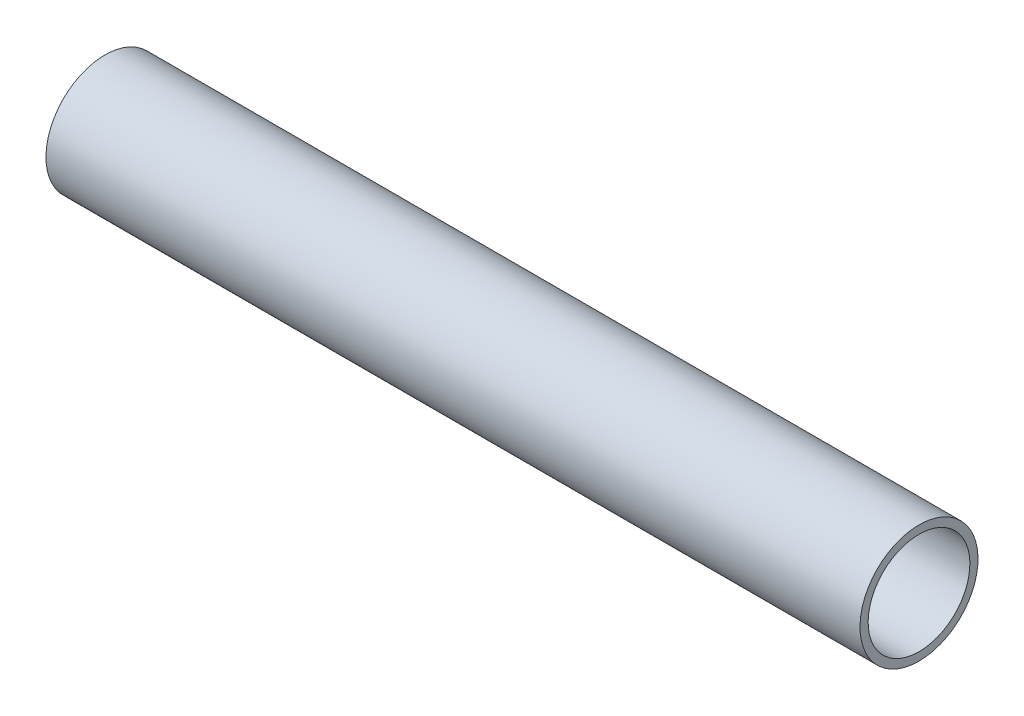
from build123d import *

# Parameters (mm, degrees)
SKETCH1_R           = 14.5
SKETCH1_R_2         = 12.5
BOSS_EXTRUDE1_DEPTH = 100


with BuildPart() as part:
    # Sketch1 → Boss-Extrude1 (new, symmetric)
    with BuildSketch(Plane.ZY.offset(15.527905639)):
        with Locations((50, 105.869562716)):
            Circle(SKETCH1_R)
        with Locations((50, 105.869562716)):
            Circle(SKETCH1_R_2, mode=Mode.SUBTRACT)
    extrude(amount=BOSS_EXTRUDE1_DEPTH, both=True)


solid = part.part
